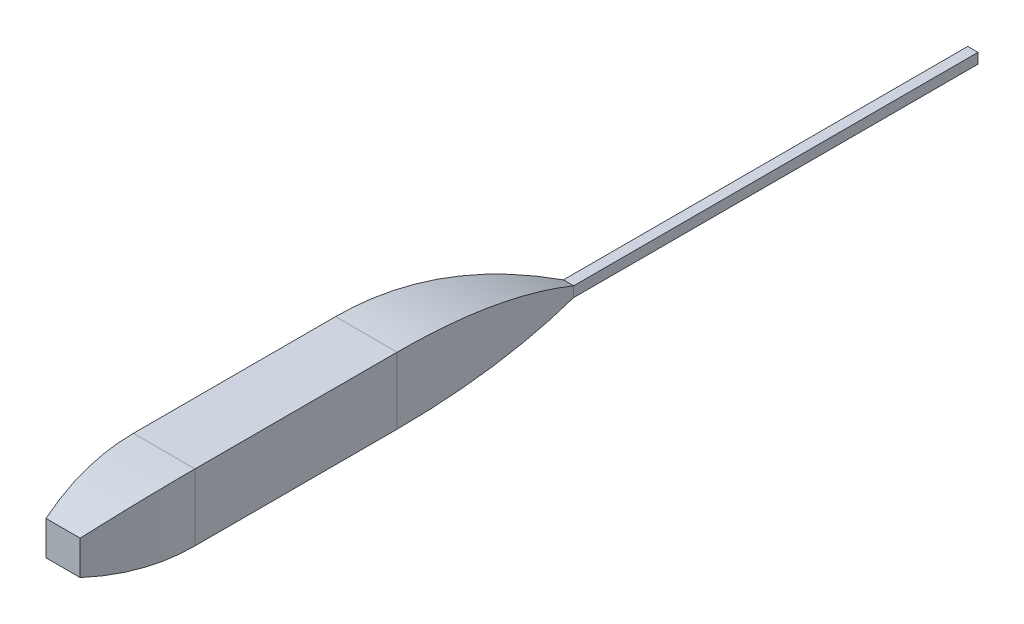
from build123d import *

# Parameters (mm, degrees)
BOSS_EXTRUDE1_DEPTH      = 50
BOSS_EXTRUDE1_DEPTH_BACK = 50
CUT_EXTRUDE1_DEPTH       = 50
CUT_EXTRUDE1_DEPTH_BACK  = 50
SKETCH3_OUTSIDE_W        = 1067.328
SKETCH3_OUTSIDE_H        = 280.828


with BuildPart() as part:
    # Sketch4 → Boss-Extrude1 (new, two sides: drawn at the far end of the back side and taken through both)
    with BuildSketch(Plane(origin=(0, 0, 0), x_dir=(1, 0, 0), z_dir=(0, 1, 0)).offset(-BOSS_EXTRUDE1_DEPTH_BACK)):
        with BuildLine():
            Line((-16.642135624, 0), (16.642135624, 0))
            add(Edge.make_bspline(
                [(30, 98.5), (30, 49.25), (16.642135624, 0)],
                knots=[0, 0, 0, 1, 1, 1], degree=2))
            Line((30, 98.5), (30, 295.5))
            add(Edge.make_bspline(
                [(30, 295.5), (30, 394), (5, 492.5)],
                knots=[0, 0, 0, 1, 1, 1], degree=2))
            Line((5, 492.5), (5, 886.5))
            Line((5, 886.5), (-5, 886.5))
            Line((-5, 886.5), (-5, 492.5))
            add(Edge.make_bspline(
                [(-30, 295.5), (-30, 394), (-5, 492.5)],
                knots=[0, 0, 0, 1, 1, 1], degree=2))
            Line((-30, 295.5), (-30, 98.5))
            add(Edge.make_bspline(
                [(-30, 98.5), (-30, 49.25), (-16.642135624, 0)],
                knots=[0, 0, 0, 1, 1, 1], degree=2))
        make_face()
    extrude(amount=BOSS_EXTRUDE1_DEPTH + BOSS_EXTRUDE1_DEPTH_BACK)

    # Sketch3 outside → Cut-Extrude1 (cut, two sides: drawn at the far end of the back side and taken through both)
    with BuildSketch(Plane(origin=(0, 0, 0), x_dir=(0, 0, -1), z_dir=(1, 0, 0)).offset(-CUT_EXTRUDE1_DEPTH_BACK)):
        with Locations((443.25, 0)):
            Rectangle(SKETCH3_OUTSIDE_W, SKETCH3_OUTSIDE_H)
        with BuildLine():
            Line((295.5, -32.5), (985, -32.5))
            Line((985, -32.5), (985, -22.5))
            Line((985, -22.5), (492.5, -22.5))
            add(Edge.make_bspline(
                [(295.5, 32.5), (394, 32.5), (492.5, -22.5)],
                knots=[0, 0, 0, 1, 1, 1], degree=2))
            Line((295.5, 32.5), (98.5, 32.5))
            add(Edge.make_bspline(
                [(0, 16.642135624), (49.25, 32.5), (98.5, 32.5)],
                knots=[0, 0, 0, 1, 1, 1], degree=2))
            Line((0, 16.642135624), (0, -16.642135624))
            add(Edge.make_bspline(
                [(0, -16.642135624), (49.25, -32.5), (98.5, -32.5)],
                knots=[0, 0, 0, 1, 1, 1], degree=2))
            Line((98.5, -32.5), (295.5, -32.5))
        make_face(mode=Mode.SUBTRACT)
    extrude(amount=CUT_EXTRUDE1_DEPTH + CUT_EXTRUDE1_DEPTH_BACK, mode=Mode.SUBTRACT)


solid = part.part
